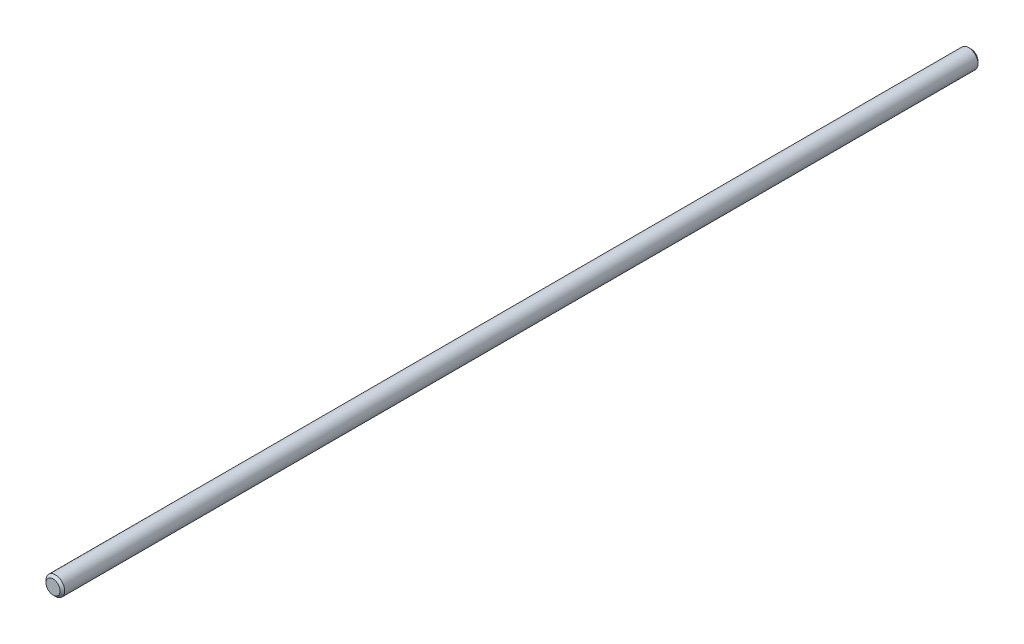
from build123d import *

# Parameters (mm, degrees)
SKETCH1_R           = 4
BOSS_EXTRUDE1_DEPTH = 392
CHAMFER1_SIZE       = 1


with BuildPart() as part:
    # Sketch1 → Boss-Extrude1 (new body)
    with BuildSketch(Plane.XY):
        Circle(SKETCH1_R)
    extrude(amount=BOSS_EXTRUDE1_DEPTH)

    # Chamfer1
    chamfer1_edges = [part.edges().sort_by_distance(p)[0] for p in [
        (-4, 0, 392),
        (-4, 0, 0),
    ]]
    chamfer(chamfer1_edges, length=CHAMFER1_SIZE)


solid = part.part
